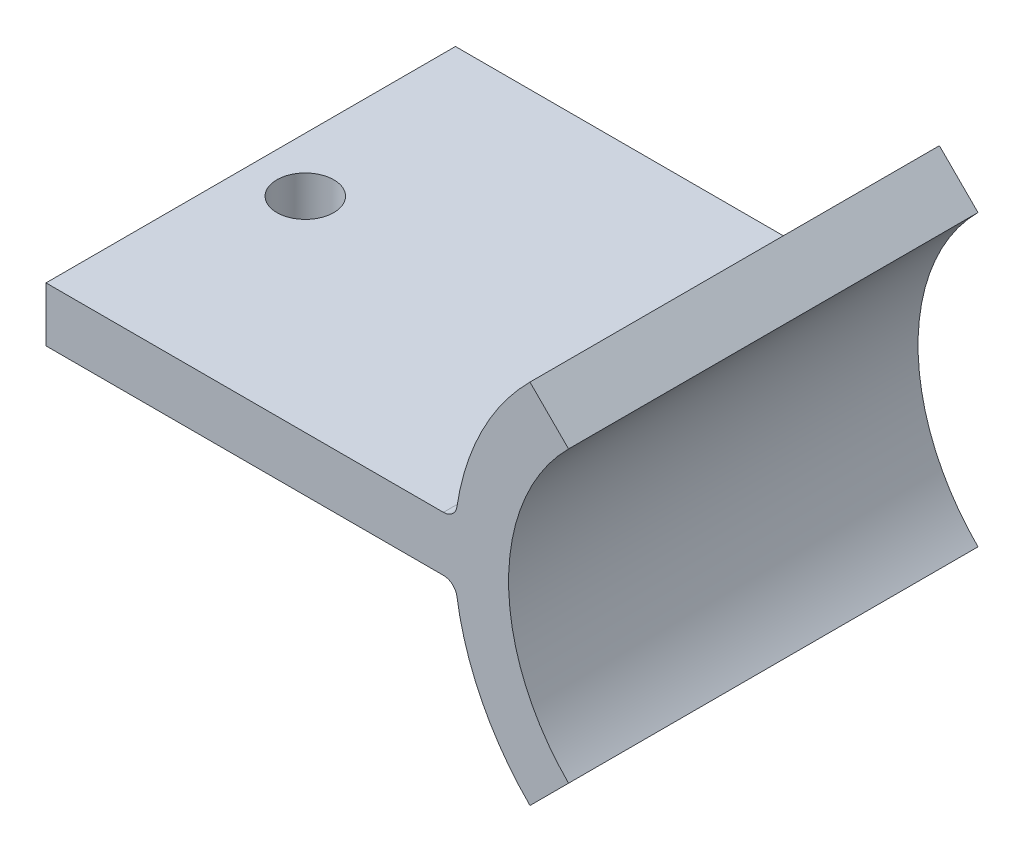
from build123d import *

# Parameters (mm, degrees)
BOSS_EXTRUDE1_DEPTH  = 19.05
M5_CLEARANCE_HOLE1_D = 5.3
FILLET1_R            = 1.27


with BuildPart() as part:
    # Sketch1 → Boss-Extrude1 (new, symmetric)
    with BuildSketch(Plane.XY):
        with BuildLine():
            Line((5.57961581839625, -13.470384181603707), (1.987513369968585, -17.06248663003137))
            ThreePointArc((1.987513369968585, -17.06248663003137), (-2.725544166788481, -10.39627703749012), (-4.945943407167808, -2.539999999999996))
            Line((-4.945943407167808, -2.539999999999996), (-43.04594340716781, -2.540000000000002))
            Line((-43.04594340716781, -2.540000000000002), (-43.04594340716781, 2.5399999999999987))
            Line((-43.04594340716781, 2.5399999999999987), (-4.945943407167809, 2.5399999999999956))
            ThreePointArc((-4.945943407167809, 2.5399999999999956), (-2.7255441667884845, 10.39627703749011), (1.9875133699685803, 17.062486630031362))
            Line((1.9875133699685803, 17.062486630031362), (5.57961581839625, 13.470384181603707))
            ThreePointArc((5.57961581839625, 13.470384181603707), (0, -2.33e-15), (5.57961581839625, -13.470384181603707))
        make_face()
    extrude(amount=BOSS_EXTRUDE1_DEPTH, both=True)

    # Sketch3 → Cut-Revolve1 (revolve, cut)
    with BuildSketch(Plane(origin=(0, 0, 0), x_dir=(1, 0, 0), z_dir=(0, 1, 0))):
        Polygon((-5.080000000000001, 15.239999999999998), (-5.079999999999999, 10.159999999999997), (-7.619999999999999, 10.159999999999995), (-7.620000000000001, 15.239999999999998), align=None)
        Polygon((-7.6200000000000045, -15.239999999999998), (-7.620000000000003, -10.159999999999995), (-5.080000000000003, -10.159999999999997), (-5.0800000000000045, -15.239999999999998), align=None)
    revolve(axis=Axis((19.049999999999997, 0, 19.05), (0, 0, -1)), mode=Mode.SUBTRACT)

    # M5 Clearance Hole1 (through all)
    with Locations(Plane(origin=(2.3e-16, 2.539999999999995, 0), x_dir=(1, -1.3e-15, 0), z_dir=(1.3e-15, 1, 0))):
        with Locations((-37.965943407, 0)):
            Hole(M5_CLEARANCE_HOLE1_D / 2)

    # Fillet1
    # the kernel refuses this fillet: 1.27 mm, written as the material it adds along each edge
    with BuildSketch(Plane(origin=(19.049999999999997, 0, 10.159999999999995), x_dir=(-0.977097634311174, 0.21279147779811838, 0), z_dir=(0.21279147779811838, 0.977097634311174, 0))) as fillet1_piece_1_section:
        with BuildLine():
            CenterArc((26.669999999999998 - FILLET1_R, FILLET1_R), FILLET1_R, 270, 90)
            Line((26.669999999999998, FILLET1_R), (26.669999999999998, 0))
            Line((26.669999999999998, 0), (26.669999999999998 - FILLET1_R, 0))
        make_face()
    fillet1_piece_1 = revolve(axis=Axis((19.049999999999997, 0, 10.159999999999995), (0, 0, 1)), revolution_arc=24.571980666955447, mode=Mode.PRIVATE)
    fillet1_piece_1 = split(fillet1_piece_1, bisect_by=Plane(origin=(-7.291599900953605, -2.5399999999999965, 10.447516445841947), z_dir=(-1.5e-16, 1, 0)), keep=Keep.TOP, mode=Mode.PRIVATE)
    fillet1_piece_1 = split(fillet1_piece_1, bisect_by=Plane(origin=(-7.2915999009536066, 2.5399999999999956, 10.447516445841947), z_dir=(-8e-17, -1, 0)), keep=Keep.TOP, mode=Mode.PRIVATE)
    add(fillet1_piece_1)
    with BuildSketch(Plane(origin=(19.049999999999997, 0, 10.159999999999997), x_dir=(-0.97203785589273, -0.23482420384505578, 0), z_dir=(0.23482420384505578, -0.97203785589273, 0))) as fillet1_piece_2_section:
        with BuildLine():
            CenterArc((24.130000000000003 + FILLET1_R, -FILLET1_R), FILLET1_R, 90, 90)
            Line((24.130000000000003 + FILLET1_R, 1.78e-15), (24.130000000000003, 1.78e-15))
            Line((24.130000000000003, 1.78e-15), (24.130000000000003, -FILLET1_R))
        make_face()
    fillet1_piece_2 = revolve(axis=Axis((19.049999999999997, 0, 10.159999999999997), (0, 0, -1)), revolution_arc=13.581260422554433, mode=Mode.PRIVATE)
    fillet1_piece_2 = split(fillet1_piece_2, bisect_by=Plane(origin=(-5.323332867248744, -2.539999999999996, 10.44752827133116), z_dir=(-1.5e-16, 1, 0)), keep=Keep.TOP, mode=Mode.PRIVATE)
    add(fillet1_piece_2)
    with BuildSketch(Plane(origin=(19.049999999999997, 0, 15.239999999999998), x_dir=(-1, 0, 0), z_dir=(0, -1, 0))) as fillet1_piece_3_section:
        with BuildLine():
            CenterArc((24.130000000000003 + FILLET1_R, FILLET1_R), FILLET1_R, 180, 90.00000000000017)
            Line((24.130000000000003 + FILLET1_R, 0), (24.130000000000003, 0))
            Line((24.130000000000003, 0), (24.13, FILLET1_R))
        make_face()
    fillet1_piece_3 = revolve(axis=Axis((19.049999999999997, 0, 15.239999999999998), (0, 0, -1)), revolution_arc=13.581260422554424, mode=Mode.PRIVATE)
    fillet1_piece_3 = split(fillet1_piece_3, bisect_by=Plane(origin=(-5.3233331057064674, 2.5399999999999956, 14.952471726792393), z_dir=(-8e-17, -1, 0)), keep=Keep.TOP, mode=Mode.PRIVATE)
    add(fillet1_piece_3)
    with BuildSketch(Plane(origin=(19.049999999999997, 0, 15.239999999999998), x_dir=(-0.977097634311174, 0.21279147779811838, 0), z_dir=(0.21279147779811838, 0.977097634311174, 0))) as fillet1_piece_4_section:
        with BuildLine():
            CenterArc((26.669999999999998 - FILLET1_R, -FILLET1_R), FILLET1_R, 0, 90)
            Line((26.669999999999998, -FILLET1_R), (26.669999999999998, 0))
            Line((26.669999999999998, 0), (26.669999999999998 - FILLET1_R, 0))
        make_face()
    fillet1_piece_4 = revolve(axis=Axis((19.049999999999997, 0, 15.239999999999998), (0, 0, 1)), revolution_arc=24.571980666955447, mode=Mode.PRIVATE)
    fillet1_piece_4 = split(fillet1_piece_4, bisect_by=Plane(origin=(-7.2915999009536066, -2.5399999999999965, 14.952483554158047), z_dir=(-1.5e-16, 1, 0)), keep=Keep.TOP, mode=Mode.PRIVATE)
    fillet1_piece_4 = split(fillet1_piece_4, bisect_by=Plane(origin=(-7.2915999009536066, 2.5399999999999956, 14.952483554158047), z_dir=(-8e-17, -1, 0)), keep=Keep.TOP, mode=Mode.PRIVATE)
    add(fillet1_piece_4)
    with BuildSketch(Plane(origin=(19.049999999999997, 0, -10.159999999999997), x_dir=(-0.9720378558927297, -0.23482420384505664, 0), z_dir=(0.23482420384505664, -0.9720378558927297, 0))) as fillet1_piece_5_section:
        with BuildLine():
            CenterArc((24.129999999999995 + FILLET1_R, FILLET1_R), FILLET1_R, 180, 90)
            Line((24.129999999999995 + FILLET1_R, 0), (24.129999999999995, 0))
            Line((24.129999999999995, 0), (24.129999999999995, FILLET1_R))
        make_face()
    fillet1_piece_5 = revolve(axis=Axis((19.049999999999997, 0, -10.159999999999997), (0, 0, -1)), revolution_arc=13.581260422554445, mode=Mode.PRIVATE)
    fillet1_piece_5 = split(fillet1_piece_5, bisect_by=Plane(origin=(-5.32333286724874, -2.539999999999996, -10.447528271331164), z_dir=(-1.5e-16, 1, 0)), keep=Keep.TOP, mode=Mode.PRIVATE)
    add(fillet1_piece_5)
    with BuildSketch(Plane(origin=(19.049999999999997, 0, -10.159999999999993), x_dir=(-0.9770976343111741, 0.2127914777981185, 0), z_dir=(0.2127914777981185, 0.9770976343111741, 0))) as fillet1_piece_6_section:
        with BuildLine():
            CenterArc((26.669999999999995 - FILLET1_R, -FILLET1_R), FILLET1_R, 0, 90)
            Line((26.669999999999995 - FILLET1_R, -3.55e-15), (26.669999999999995, -3.55e-15))
            Line((26.669999999999995, -3.55e-15), (26.669999999999995, -FILLET1_R))
        make_face()
    fillet1_piece_6 = revolve(axis=Axis((19.049999999999997, 0, -10.159999999999993), (0, 0, 1)), revolution_arc=24.571980666955454, mode=Mode.PRIVATE)
    fillet1_piece_6 = split(fillet1_piece_6, bisect_by=Plane(origin=(-7.291599896838221, -2.5399999999999965, -10.447516449246772), z_dir=(-1.5e-16, 1, 0)), keep=Keep.TOP, mode=Mode.PRIVATE)
    fillet1_piece_6 = split(fillet1_piece_6, bisect_by=Plane(origin=(-7.291599896838221, 2.5399999999999956, -10.447516449246772), z_dir=(-8e-17, -1, 0)), keep=Keep.TOP, mode=Mode.PRIVATE)
    add(fillet1_piece_6)
    with BuildSketch(Plane(origin=(19.049999999999997, 0, -15.239999999999998), x_dir=(-0.9770976343111741, 0.21279147779811852, 0), z_dir=(0.21279147779811852, 0.9770976343111741, 0))) as fillet1_piece_7_section:
        with BuildLine():
            CenterArc((26.669999999999995 - FILLET1_R, FILLET1_R), FILLET1_R, 270, 90)
            Line((26.669999999999995, FILLET1_R), (26.669999999999995, 0))
            Line((26.669999999999995, 0), (26.669999999999995 - FILLET1_R, 0))
        make_face()
    fillet1_piece_7 = revolve(axis=Axis((19.049999999999997, 0, -15.239999999999998), (0, 0, 1)), revolution_arc=24.57198066695545, mode=Mode.PRIVATE)
    fillet1_piece_7 = split(fillet1_piece_7, bisect_by=Plane(origin=(-7.291599900953608, -2.5399999999999965, -14.952483554158045), z_dir=(-1.5e-16, 1, 0)), keep=Keep.TOP, mode=Mode.PRIVATE)
    fillet1_piece_7 = split(fillet1_piece_7, bisect_by=Plane(origin=(-7.2915999009536066, 2.5399999999999956, -14.952483554158045), z_dir=(-8e-17, -1, 0)), keep=Keep.TOP, mode=Mode.PRIVATE)
    add(fillet1_piece_7)
    with BuildSketch(Plane(origin=(19.049999999999997, 0, -15.239999999999998), x_dir=(-1, 0, 0), z_dir=(0, -1, 0))) as fillet1_piece_8_section:
        with BuildLine():
            CenterArc((24.13 + FILLET1_R, -FILLET1_R), FILLET1_R, 90, 90)
            Line((24.13 + FILLET1_R, 0), (24.13, 0))
            Line((24.13, 0), (24.13, -FILLET1_R))
        make_face()
    fillet1_piece_8 = revolve(axis=Axis((19.049999999999997, 0, -15.239999999999998), (0, 0, -1)), revolution_arc=13.581260422554415, mode=Mode.PRIVATE)
    fillet1_piece_8 = split(fillet1_piece_8, bisect_by=Plane(origin=(-5.3233331057064674, 2.5399999999999956, -14.952471726792393), z_dir=(-8e-17, -1, 0)), keep=Keep.TOP, mode=Mode.PRIVATE)
    add(fillet1_piece_8)
    with BuildSketch(Plane(origin=(-4.945943407167807, -2.539999999999996, 10.159999999999997), x_dir=(0.12766405034714182, -0.9918174682112442, 0), z_dir=(0, 0, -1))) as fillet1_piece_9:
        with BuildLine():
            CenterArc((1.1170481769540845, 1.2696769750168004), FILLET1_R, 187.33462748878583, 81.3730734414022)
            Line((-0.1425600076744228, 1.107543631077695), (0, 0))
            ThreePointArc((0, 0), (0.5442029580032722, 0.00613747468079426), (1.088405916006544, -2e-17))
        make_face()
    extrude(amount=20.319999999999993)
    with BuildSketch(Plane(origin=(-4.945943407167807, -2.539999999999996, 19.05), x_dir=(0.12766405034714182, -0.9918174682112442, 0), z_dir=(0, 0, -1)), Plane(origin=(-4.945943407167807, -2.539999999999996, -15.239999999999998), x_dir=(0.12766405034714182, -0.9918174682112442, 0), z_dir=(0, 0, -1))) as fillet1_piece_10:
        with BuildLine():
            CenterArc((1.1170481769540845, 1.2696769750168004), FILLET1_R, 187.33462748878583, 81.3730734414022)
            Line((-0.1425600076744228, 1.107543631077695), (0, 0))
            ThreePointArc((0, 0), (0.5442029580032722, 0.00613747468079426), (1.088405916006544, -2e-17))
        make_face()
    extrude(amount=3.8100000000000023)
    with BuildSketch(Plane(origin=(-4.9459434071678094, 2.5399999999999956, -15.239999999999998), x_dir=(-1, 0, 0), z_dir=(0, 0, -1)), Plane(origin=(-4.9459434071678094, 2.5399999999999956, 19.05), x_dir=(-1, 0, 0), z_dir=(0, 0, -1))) as fillet1_piece_11:
        with BuildLine():
            CenterArc((1.1166809081061766, 1.27), FILLET1_R, 188.62692655867798, 81.37307344132205)
            ThreePointArc((-0.138950307657435, 1.0795000000000146), (-0.06338789923048704, 0.5405335348765443), (0, 0))
            Line((0, 0), (1.1166809081061766, 0))
        make_face()
    extrude(amount=3.8100000000000023)
    with BuildSketch(Plane(origin=(-4.9459434071678094, 2.5399999999999956, 10.159999999999997), x_dir=(-1, 0, 0), z_dir=(0, 0, -1))) as fillet1_piece_12:
        with BuildLine():
            CenterArc((1.1166809081061766, 1.27), FILLET1_R, 188.62692655867798, 81.37307344132205)
            ThreePointArc((-0.138950307657435, 1.0795000000000146), (-0.06338789923048704, 0.5405335348765443), (0, 0))
            Line((0, 0), (1.1166809081061766, 0))
        make_face()
    extrude(amount=20.319999999999993)
    with BuildSketch(Plane(origin=(19.049999999999997, 0, -15.239999999999998), x_dir=(-0.97203785589273, -0.23482420384505578, 0), z_dir=(0.23482420384505578, -0.97203785589273, 0))) as fillet1_piece_13_section:
        with BuildLine():
            CenterArc((24.130000000000003 + FILLET1_R, -FILLET1_R), FILLET1_R, 90, 90)
            Line((24.130000000000003 + FILLET1_R, 0), (24.130000000000003, 0))
            Line((24.130000000000003, 0), (24.130000000000003, -FILLET1_R))
        make_face()
    fillet1_piece_13 = revolve(axis=Axis((19.049999999999997, 0, -15.239999999999998), (0, 0, -1)), revolution_arc=13.581260422554433, mode=Mode.PRIVATE)
    fillet1_piece_13 = split(fillet1_piece_13, bisect_by=Plane(origin=(-5.323332867248744, -2.539999999999996, -14.952471728668833), z_dir=(-1.5e-16, 1, 0)), keep=Keep.TOP, mode=Mode.PRIVATE)
    add(fillet1_piece_13)
    with BuildSketch(Plane(origin=(19.049999999999997, 0, -10.159999999999997), x_dir=(-1, 0, 0), z_dir=(0, -1, 0))) as fillet1_piece_14_section:
        with BuildLine():
            CenterArc((24.129999999999995 + FILLET1_R, FILLET1_R), FILLET1_R, 180, 89.99999999999983)
            Line((24.129999999999995 + FILLET1_R, 0), (24.129999999999995, 0))
            Line((24.129999999999995, 0), (24.13, FILLET1_R))
        make_face()
    fillet1_piece_14 = revolve(axis=Axis((19.049999999999997, 0, -10.159999999999997), (0, 0, -1)), revolution_arc=13.581260422554427, mode=Mode.PRIVATE)
    fillet1_piece_14 = split(fillet1_piece_14, bisect_by=Plane(origin=(-5.32333310570646, 2.5399999999999956, -10.447528273207606), z_dir=(-8e-17, -1, 0)), keep=Keep.TOP, mode=Mode.PRIVATE)
    add(fillet1_piece_14)
    with BuildSketch(Plane(origin=(19.049999999999997, 0, 15.239999999999998), x_dir=(-0.9720378558927298, -0.23482420384505664, 0), z_dir=(0.23482420384505664, -0.9720378558927298, 0))) as fillet1_piece_15_section:
        with BuildLine():
            CenterArc((24.130000000000003 + FILLET1_R, FILLET1_R), FILLET1_R, 180, 90)
            Line((24.130000000000003 + FILLET1_R, 0), (24.130000000000003, 0))
            Line((24.130000000000003, 0), (24.130000000000003, FILLET1_R))
        make_face()
    fillet1_piece_15 = revolve(axis=Axis((19.049999999999997, 0, 15.239999999999998), (0, 0, -1)), revolution_arc=13.581260422554445, mode=Mode.PRIVATE)
    fillet1_piece_15 = split(fillet1_piece_15, bisect_by=Plane(origin=(-5.323332867248749, -2.539999999999996, 14.952471728668836), z_dir=(-1.5e-16, 1, 0)), keep=Keep.TOP, mode=Mode.PRIVATE)
    add(fillet1_piece_15)
    with BuildSketch(Plane(origin=(19.049999999999997, 0, 10.159999999999997), x_dir=(-1, 0, 0), z_dir=(0, -1, 0))) as fillet1_piece_16_section:
        with BuildLine():
            CenterArc((24.13 + FILLET1_R, -FILLET1_R), FILLET1_R, 90, 90)
            Line((24.13 + FILLET1_R, 0), (24.13, 0))
            Line((24.13, 0), (24.13, -FILLET1_R))
        make_face()
    fillet1_piece_16 = revolve(axis=Axis((19.049999999999997, 0, 10.159999999999997), (0, 0, -1)), revolution_arc=13.581260422554415, mode=Mode.PRIVATE)
    fillet1_piece_16 = split(fillet1_piece_16, bisect_by=Plane(origin=(-5.3233331057064674, 2.5399999999999956, 10.447528273207606), z_dir=(-8e-17, -1, 0)), keep=Keep.TOP, mode=Mode.PRIVATE)
    add(fillet1_piece_16)
    with BuildSketch(Plane(origin=(-4.945943407167807, -2.539999999999996, 12.951702270265507), x_dir=(0.12766405034714182, -0.9918174682112442, 0), z_dir=(0, 0, -1))) as fillet1_piece_17a_section:
        with BuildLine():
            CenterArc((1.1170481769540845, 1.2696769750168004), FILLET1_R, 187.33462748878583, 81.3730734414022)
            Line((-0.1425600076744228, 1.107543631077695), (0, 0))
            ThreePointArc((0, 0), (0.5442029580032722, 0.00613747468079426), (1.088405916006544, -2e-17))
        make_face()
    fillet1_piece_17a = extrude(amount=23.111702270265504, mode=Mode.PRIVATE)
    fillet1_piece_17a = split(fillet1_piece_17a, bisect_by=Plane(origin=(-5.169208228517128, -2.781117736430252, 10.159999999999995), z_dir=(0, 0, 1)), keep=Keep.TOP, mode=Mode.PRIVATE)
    with BuildSketch(Plane(origin=(19.049999999999997, 0, 10.159999999999997), x_dir=(-0.97203785589273, -0.23482420384505578, 0), z_dir=(0.23482420384505578, -0.97203785589273, 0))) as fillet1_piece_17b_section:
        with BuildLine():
            CenterArc((24.130000000000003 + FILLET1_R, -FILLET1_R), FILLET1_R, 90, 90)
            Line((24.130000000000003 + FILLET1_R, 1.78e-15), (24.130000000000003, 1.78e-15))
            Line((24.130000000000003, 1.78e-15), (24.130000000000003, -FILLET1_R))
        make_face()
    fillet1_piece_17b = revolve(axis=Axis((19.049999999999997, 0, 10.159999999999997), (0, 0, -1)), revolution_arc=13.581260422554433, mode=Mode.PRIVATE)
    fillet1_piece_17b = split(fillet1_piece_17b, bisect_by=Plane(origin=(-5.000706985946909, -2.539999999999996, 10.444279944253609), z_dir=(1.5e-16, -1, 0)), keep=Keep.TOP, mode=Mode.PRIVATE)
    fillet1_piece_17 = fillet1_piece_17a & fillet1_piece_17b
    add(fillet1_piece_17)
    with BuildSketch(Plane(origin=(-4.9459434071678094, 2.5399999999999956, 19.05), x_dir=(-1, 0, 0), z_dir=(0, 0, -1))) as fillet1_piece_18a_section:
        with BuildLine():
            CenterArc((1.1166809081061766, 1.27), FILLET1_R, 188.62692655867798, 81.37307344132205)
            ThreePointArc((-0.138950307657435, 1.0795000000000146), (-0.06338789923048704, 0.5405335348765443), (0, 0))
            Line((0, 0), (1.1166809081061766, 0))
        make_face()
    fillet1_piece_18a = extrude(amount=6.601702270265445, mode=Mode.PRIVATE)
    fillet1_piece_18a = split(fillet1_piece_18a, bisect_by=Plane(origin=(-5.169208228517213, 2.781117736431367, 15.239999999999998), z_dir=(0, 0, -1)), keep=Keep.TOP, mode=Mode.PRIVATE)
    with BuildSketch(Plane(origin=(19.049999999999997, 0, 15.239999999999998), x_dir=(-1, 0, 0), z_dir=(0, -1, 0))) as fillet1_piece_18b_section:
        with BuildLine():
            CenterArc((24.130000000000003 + FILLET1_R, FILLET1_R), FILLET1_R, 180, 90.00000000000017)
            Line((24.130000000000003 + FILLET1_R, 0), (24.130000000000003, 0))
            Line((24.130000000000003, 0), (24.13, FILLET1_R))
        make_face()
    fillet1_piece_18b = revolve(axis=Axis((19.049999999999997, 0, 15.239999999999998), (0, 0, -1)), revolution_arc=13.581260422554424, mode=Mode.PRIVATE)
    fillet1_piece_18b = split(fillet1_piece_18b, bisect_by=Plane(origin=(-5.000706512259434, 2.5399999999999956, 14.955719927842757), z_dir=(8e-17, 1, 0)), keep=Keep.TOP, mode=Mode.PRIVATE)
    fillet1_piece_18 = fillet1_piece_18a & fillet1_piece_18b
    add(fillet1_piece_18)
    with BuildSketch(Plane(origin=(-4.945943407167807, -2.539999999999996, 10.159999999999997), x_dir=(0.12766405034714182, -0.9918174682112442, 0), z_dir=(0, 0, -1))) as fillet1_piece_19a_section:
        with BuildLine():
            CenterArc((1.1170481769540845, 1.2696769750168004), FILLET1_R, 187.33462748878583, 81.3730734414022)
            Line((-0.1425600076744228, 1.107543631077695), (0, 0))
            ThreePointArc((0, 0), (0.5442029580032722, 0.00613747468079426), (1.088405916006544, -2e-17))
        make_face()
    fillet1_piece_19a = extrude(amount=23.111702270265507, mode=Mode.PRIVATE)
    fillet1_piece_19a = split(fillet1_piece_19a, bisect_by=Plane(origin=(-5.169208228517128, -2.7811177364302493, -10.159999999999997), z_dir=(0, 0, -1)), keep=Keep.TOP, mode=Mode.PRIVATE)
    with BuildSketch(Plane(origin=(19.049999999999997, 0, -10.159999999999997), x_dir=(-0.9720378558927297, -0.23482420384505664, 0), z_dir=(0.23482420384505664, -0.9720378558927297, 0))) as fillet1_piece_19b_section:
        with BuildLine():
            CenterArc((24.129999999999995 + FILLET1_R, FILLET1_R), FILLET1_R, 180, 90)
            Line((24.129999999999995 + FILLET1_R, 0), (24.129999999999995, 0))
            Line((24.129999999999995, 0), (24.129999999999995, FILLET1_R))
        make_face()
    fillet1_piece_19b = revolve(axis=Axis((19.049999999999997, 0, -10.159999999999997), (0, 0, -1)), revolution_arc=13.581260422554445, mode=Mode.PRIVATE)
    fillet1_piece_19b = split(fillet1_piece_19b, bisect_by=Plane(origin=(-5.000706985946903, -2.539999999999996, -10.444279944253614), z_dir=(1.5e-16, -1, 0)), keep=Keep.TOP, mode=Mode.PRIVATE)
    fillet1_piece_19 = fillet1_piece_19a & fillet1_piece_19b
    add(fillet1_piece_19)
    with BuildSketch(Plane(origin=(-4.945943407167803, 2.5399999999999956, -12.448297729734556), x_dir=(-1, 0, 0), z_dir=(0, 0, -1))) as fillet1_piece_20a_section:
        with BuildLine():
            CenterArc((1.1166809081061828, 1.27), FILLET1_R, 188.62692655867798, 81.37307344132205)
            ThreePointArc((-0.13895030765742877, 1.0795000000000146), (-0.06338789923047727, 0.5405335348765479), (0, 0))
            Line((0, 0), (1.1166809081061828, 0))
        make_face()
    fillet1_piece_20a = extrude(amount=6.601702270265445, mode=Mode.PRIVATE)
    fillet1_piece_20a = split(fillet1_piece_20a, bisect_by=Plane(origin=(-5.169208228517213, 2.781117736431371, -15.239999999999998), z_dir=(0, 0, 1)), keep=Keep.TOP, mode=Mode.PRIVATE)
    with BuildSketch(Plane(origin=(19.049999999999997, 0, -15.239999999999998), x_dir=(-1, 0, 0), z_dir=(0, -1, 0))) as fillet1_piece_20b_section:
        with BuildLine():
            CenterArc((24.13 + FILLET1_R, -FILLET1_R), FILLET1_R, 90, 90)
            Line((24.13 + FILLET1_R, 0), (24.13, 0))
            Line((24.13, 0), (24.13, -FILLET1_R))
        make_face()
    fillet1_piece_20b = revolve(axis=Axis((19.049999999999997, 0, -15.239999999999998), (0, 0, -1)), revolution_arc=13.581260422554415, mode=Mode.PRIVATE)
    fillet1_piece_20b = split(fillet1_piece_20b, bisect_by=Plane(origin=(-5.000706512259434, 2.5399999999999956, -14.955719927842756), z_dir=(8e-17, 1, 0)), keep=Keep.TOP, mode=Mode.PRIVATE)
    fillet1_piece_20 = fillet1_piece_20a & fillet1_piece_20b
    add(fillet1_piece_20)
    with BuildSketch(Plane(origin=(-4.945943407167807, -2.539999999999996, 19.05), x_dir=(0.12766405034714182, -0.9918174682112442, 0), z_dir=(0, 0, -1))) as fillet1_piece_21a_section:
        with BuildLine():
            CenterArc((1.1170481769540845, 1.2696769750168004), FILLET1_R, 187.33462748878583, 81.3730734414022)
            Line((-0.1425600076744228, 1.107543631077695), (0, 0))
            ThreePointArc((0, 0), (0.5442029580032722, 0.00613747468079426), (1.088405916006544, -2e-17))
        make_face()
    fillet1_piece_21a = extrude(amount=6.601702270265513, mode=Mode.PRIVATE)
    fillet1_piece_21a = split(fillet1_piece_21a, bisect_by=Plane(origin=(-5.169208228517128, -2.7811177364302497, 15.239999999999998), z_dir=(0, 0, -1)), keep=Keep.TOP, mode=Mode.PRIVATE)
    with BuildSketch(Plane(origin=(19.049999999999997, 0, 15.239999999999998), x_dir=(-0.9720378558927298, -0.23482420384505664, 0), z_dir=(0.23482420384505664, -0.9720378558927298, 0))) as fillet1_piece_21b_section:
        with BuildLine():
            CenterArc((24.130000000000003 + FILLET1_R, FILLET1_R), FILLET1_R, 180, 90)
            Line((24.130000000000003 + FILLET1_R, 0), (24.130000000000003, 0))
            Line((24.130000000000003, 0), (24.130000000000003, FILLET1_R))
        make_face()
    fillet1_piece_21b = revolve(axis=Axis((19.049999999999997, 0, 15.239999999999998), (0, 0, -1)), revolution_arc=13.581260422554445, mode=Mode.PRIVATE)
    fillet1_piece_21b = split(fillet1_piece_21b, bisect_by=Plane(origin=(-5.00070698594691, -2.539999999999996, 14.955720055746385), z_dir=(1.5e-16, -1, 0)), keep=Keep.TOP, mode=Mode.PRIVATE)
    fillet1_piece_21 = fillet1_piece_21a & fillet1_piece_21b
    add(fillet1_piece_21)
    with BuildSketch(Plane(origin=(-4.945943407167803, 2.5399999999999956, 12.951702270265438), x_dir=(-1, 0, 0), z_dir=(0, 0, -1))) as fillet1_piece_22a_section:
        with BuildLine():
            CenterArc((1.1166809081061828, 1.27), FILLET1_R, 188.62692655867798, 81.37307344132205)
            ThreePointArc((-0.13895030765742877, 1.0795000000000146), (-0.06338789923047727, 0.5405335348765479), (0, 0))
            Line((0, 0), (1.1166809081061828, 0))
        make_face()
    fillet1_piece_22a = extrude(amount=23.111702270265432, mode=Mode.PRIVATE)
    fillet1_piece_22a = split(fillet1_piece_22a, bisect_by=Plane(origin=(-5.169208228517213, 2.7811177364313715, 10.159999999999995), z_dir=(0, 0, 1)), keep=Keep.TOP, mode=Mode.PRIVATE)
    with BuildSketch(Plane(origin=(19.049999999999997, 0, 10.159999999999997), x_dir=(-1, 0, 0), z_dir=(0, -1, 0))) as fillet1_piece_22b_section:
        with BuildLine():
            CenterArc((24.13 + FILLET1_R, -FILLET1_R), FILLET1_R, 90, 90)
            Line((24.13 + FILLET1_R, 0), (24.13, 0))
            Line((24.13, 0), (24.13, -FILLET1_R))
        make_face()
    fillet1_piece_22b = revolve(axis=Axis((19.049999999999997, 0, 10.159999999999997), (0, 0, -1)), revolution_arc=13.581260422554415, mode=Mode.PRIVATE)
    fillet1_piece_22b = split(fillet1_piece_22b, bisect_by=Plane(origin=(-5.000706512259434, 2.5399999999999956, 10.444280072157238), z_dir=(8e-17, 1, 0)), keep=Keep.TOP, mode=Mode.PRIVATE)
    fillet1_piece_22 = fillet1_piece_22a & fillet1_piece_22b
    add(fillet1_piece_22)
    with BuildSketch(Plane(origin=(-4.9459434071678094, 2.5399999999999956, 10.159999999999997), x_dir=(-1, 0, 0), z_dir=(0, 0, -1))) as fillet1_piece_23a_section:
        with BuildLine():
            CenterArc((1.1166809081061766, 1.27), FILLET1_R, 188.62692655867798, 81.37307344132205)
            ThreePointArc((-0.138950307657435, 1.0795000000000146), (-0.06338789923048704, 0.5405335348765443), (0, 0))
            Line((0, 0), (1.1166809081061766, 0))
        make_face()
    fillet1_piece_23a = extrude(amount=23.111702270265436, mode=Mode.PRIVATE)
    fillet1_piece_23a = split(fillet1_piece_23a, bisect_by=Plane(origin=(-5.169208228517217, 2.781117736431367, -10.159999999999997), z_dir=(0, 0, -1)), keep=Keep.TOP, mode=Mode.PRIVATE)
    with BuildSketch(Plane(origin=(19.049999999999997, 0, -10.159999999999997), x_dir=(-1, 0, 0), z_dir=(0, -1, 0))) as fillet1_piece_23b_section:
        with BuildLine():
            CenterArc((24.129999999999995 + FILLET1_R, FILLET1_R), FILLET1_R, 180, 89.99999999999983)
            Line((24.129999999999995 + FILLET1_R, 0), (24.129999999999995, 0))
            Line((24.129999999999995, 0), (24.13, FILLET1_R))
        make_face()
    fillet1_piece_23b = revolve(axis=Axis((19.049999999999997, 0, -10.159999999999997), (0, 0, -1)), revolution_arc=13.581260422554427, mode=Mode.PRIVATE)
    fillet1_piece_23b = split(fillet1_piece_23b, bisect_by=Plane(origin=(-5.000706512259427, 2.5399999999999956, -10.44428007215724), z_dir=(8e-17, 1, 0)), keep=Keep.TOP, mode=Mode.PRIVATE)
    fillet1_piece_23 = fillet1_piece_23a & fillet1_piece_23b
    add(fillet1_piece_23)
    with BuildSketch(Plane(origin=(-4.945943407167807, -2.539999999999996, -12.448297729734488), x_dir=(0.12766405034714182, -0.9918174682112442, 0), z_dir=(0, 0, -1))) as fillet1_piece_24a_section:
        with BuildLine():
            CenterArc((1.1170481769540845, 1.2696769750168004), FILLET1_R, 187.33462748878583, 81.3730734414022)
            Line((-0.1425600076744228, 1.107543631077695), (0, 0))
            ThreePointArc((0, 0), (0.5442029580032722, 0.00613747468079426), (1.088405916006544, -2e-17))
        make_face()
    fillet1_piece_24a = extrude(amount=6.601702270265513, mode=Mode.PRIVATE)
    fillet1_piece_24a = split(fillet1_piece_24a, bisect_by=Plane(origin=(-5.169208228517128, -2.7811177364302524, -15.239999999999998), z_dir=(0, 0, 1)), keep=Keep.TOP, mode=Mode.PRIVATE)
    with BuildSketch(Plane(origin=(19.049999999999997, 0, -15.239999999999998), x_dir=(-0.97203785589273, -0.23482420384505578, 0), z_dir=(0.23482420384505578, -0.97203785589273, 0))) as fillet1_piece_24b_section:
        with BuildLine():
            CenterArc((24.130000000000003 + FILLET1_R, -FILLET1_R), FILLET1_R, 90, 90)
            Line((24.130000000000003 + FILLET1_R, 0), (24.130000000000003, 0))
            Line((24.130000000000003, 0), (24.130000000000003, -FILLET1_R))
        make_face()
    fillet1_piece_24b = revolve(axis=Axis((19.049999999999997, 0, -15.239999999999998), (0, 0, -1)), revolution_arc=13.581260422554433, mode=Mode.PRIVATE)
    fillet1_piece_24b = split(fillet1_piece_24b, bisect_by=Plane(origin=(-5.000706985946908, -2.539999999999996, -14.955720055746387), z_dir=(1.5e-16, -1, 0)), keep=Keep.TOP, mode=Mode.PRIVATE)
    fillet1_piece_24 = fillet1_piece_24a & fillet1_piece_24b
    add(fillet1_piece_24)


solid = part.part
